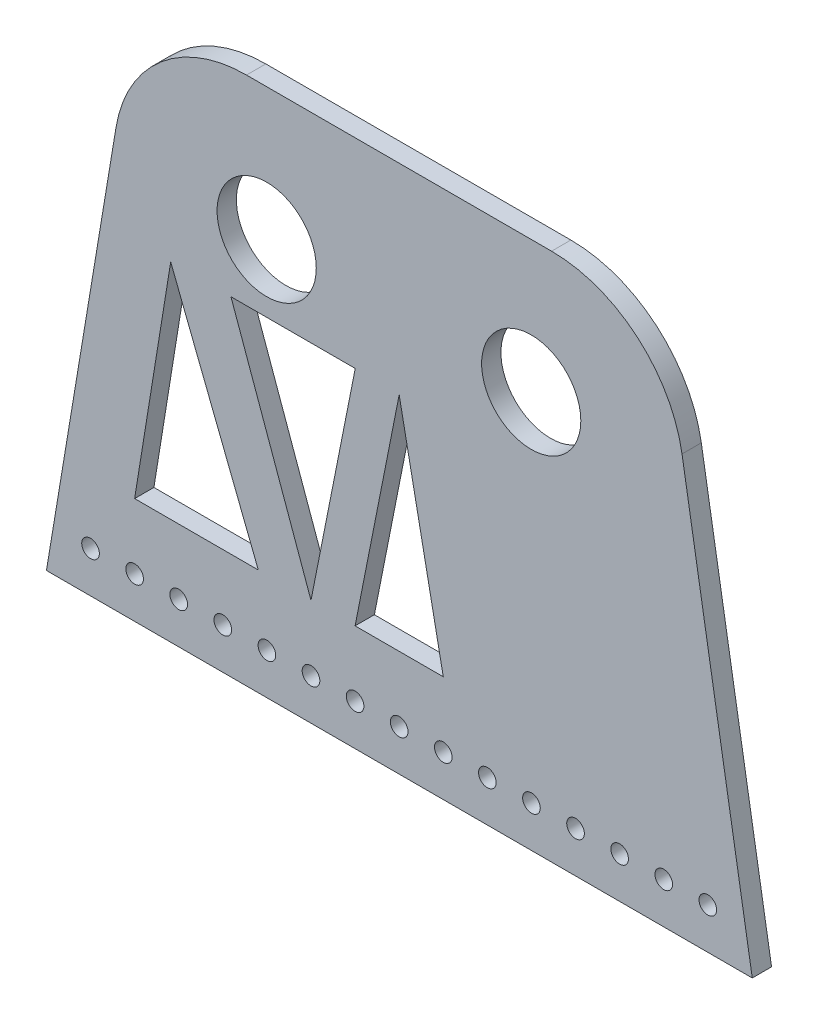
from build123d import *

# Parameters (mm, degrees)
SKETCH2_R           = 14.2875
SKETCH2_R_2         = 2.54
BOSS_EXTRUDE1_DEPTH = 5.55625
FILLET1_R           = 38.1


with BuildPart() as part:
    # Sketch2 → Boss-Extrude1 (new body)
    with BuildSketch(Plane.XY):
        Polygon((-33.221954044, -123.033671084), (-58.55568732, -123.033671084), (-33.221954044, 29.366328916), (119.178045956, 29.366328916), (144.745882617, -123.033671084), (119.178045956, -123.033671084), align=None)
        with Locations((4.878045956, -8.733671084)):
            Circle(SKETCH2_R, mode=Mode.SUBTRACT)
        with Locations((81.078045956, -8.733671084)):
            Circle(SKETCH2_R, mode=Mode.SUBTRACT)
        with Locations((-45.85568732, -111.187710863)):
            Circle(SKETCH2_R_2, mode=Mode.SUBTRACT)
        with Locations((-33.15568732, -111.187710863)):
            Circle(SKETCH2_R_2, mode=Mode.SUBTRACT)
        with Locations((-20.45568732, -111.187710863)):
            Circle(SKETCH2_R_2, mode=Mode.SUBTRACT)
        with Locations((-7.75568732, -111.187710863)):
            Circle(SKETCH2_R_2, mode=Mode.SUBTRACT)
        with Locations((4.94431268, -111.187710863)):
            Circle(SKETCH2_R_2, mode=Mode.SUBTRACT)
        with Locations((17.64431268, -111.187710863)):
            Circle(SKETCH2_R_2, mode=Mode.SUBTRACT)
        with Locations((30.34431268, -111.187710863)):
            Circle(SKETCH2_R_2, mode=Mode.SUBTRACT)
        with Locations((43.04431268, -111.187710863)):
            Circle(SKETCH2_R_2, mode=Mode.SUBTRACT)
        with Locations((55.74431268, -111.187710863)):
            Circle(SKETCH2_R_2, mode=Mode.SUBTRACT)
        with Locations((68.44431268, -111.187710863)):
            Circle(SKETCH2_R_2, mode=Mode.SUBTRACT)
        with Locations((81.14431268, -111.187710863)):
            Circle(SKETCH2_R_2, mode=Mode.SUBTRACT)
        with Locations((93.84431268, -111.187710863)):
            Circle(SKETCH2_R_2, mode=Mode.SUBTRACT)
        with Locations((106.54431268, -111.187710863)):
            Circle(SKETCH2_R_2, mode=Mode.SUBTRACT)
        with Locations((119.24431268, -111.187710863)):
            Circle(SKETCH2_R_2, mode=Mode.SUBTRACT)
        with Locations((131.94431268, -111.187710863)):
            Circle(SKETCH2_R_2, mode=Mode.SUBTRACT)
        Polygon((-22.767796965, -28.16783361), (-33.15568732, -92.394571291), (2.468038836, -92.394571291), align=None, mode=Mode.SUBTRACT)
        Polygon((43.04431268, -28.399699089), (55.74431268, -92.394571291), (30.34431268, -92.394571291), align=None, mode=Mode.SUBTRACT)
        Polygon((17.64431268, -92.394571291), (30.390327173, -28.16783361), (-5.41538745, -28.16783361), align=None, mode=Mode.SUBTRACT)
    extrude(amount=BOSS_EXTRUDE1_DEPTH)

    # Fillet1
    fillet1_edges = [part.edges().sort_by_distance(p)[0] for p in [
        (-33.221954044, 29.366328916, 2.778125),
        (119.178045956, 29.366328916, 2.778125),
    ]]
    fillet(fillet1_edges, radius=FILLET1_R)


solid = part.part
